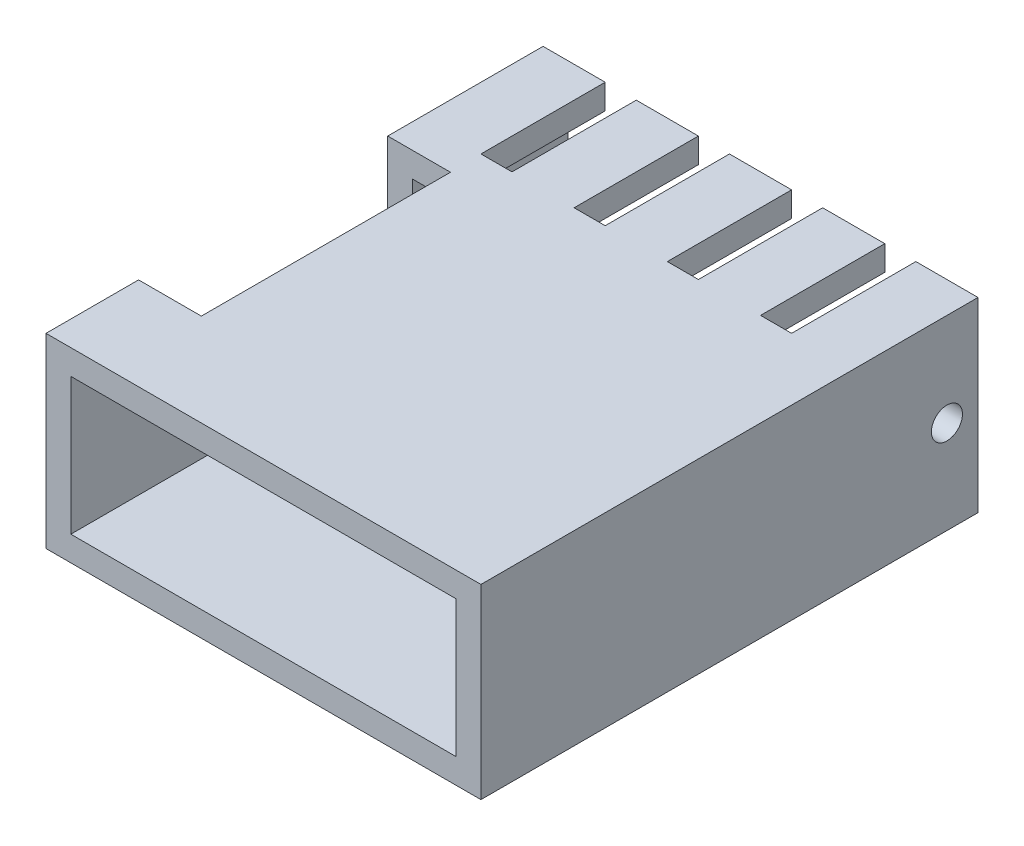
from build123d import *

# Parameters (mm, degrees)
SKETCH1_W               = 88.9
SKETCH1_H               = 101.6
BOSS_EXTRUDE1_DEPTH     = 38.1
SHELL1_T                = -5.08
CUT_EXTRUDE3_START      = -19.05
SKETCH4_W               = 12.827
SKETCH4_H               = 50.927
CUT_EXTRUDE3_DEPTH      = 122.226084918
SKETCH5_W               = 6.35
SKETCH5_H               = 25.4
CUT_EXTRUDE4_DEPTH      = 141.276084918
CUT_EXTRUDE5_DEPTH      = 4.2672
CUT_EXTRUDE5_DEPTH_BACK = 141.276084918
SKETCH6_R               = 3.175


with BuildPart() as part:
    # Sketch1 → Boss-Extrude1 (new body)
    with BuildSketch(Plane(origin=(0, 0, 0), x_dir=(1, 0, 0), z_dir=(0, 1, 0))):
        with Locations((44.45, 50.8)):
            Rectangle(SKETCH1_W, SKETCH1_H)
    extrude(amount=BOSS_EXTRUDE1_DEPTH)

    # Shell1
    shell1_openings = [part.faces().sort_by_distance(p)[0] for p in [
        (44.45, 19.05, -101.6),
        (44.45, 19.05, 0),
    ]]
    offset(amount=SHELL1_T, openings=shell1_openings, kind=Kind.INTERSECTION)

    # Sketch4 → Cut-Extrude3 (cut, through all)
    with BuildSketch(Plane.XZ.offset(CUT_EXTRUDE3_START)):
        with Locations((6.4135, -44.3865)):
            Rectangle(SKETCH4_W, SKETCH4_H)
    extrude(amount=-CUT_EXTRUDE3_DEPTH, mode=Mode.SUBTRACT)

    # Sketch5 → Cut-Extrude4 (cut, through all)
    with BuildSketch(Plane(origin=(0, 38.1, 0), x_dir=(1, 0, 0), z_dir=(0, 1, 0))):
        with Locations((15.875, 88.9)):
            Rectangle(SKETCH5_W, SKETCH5_H)
        with Locations((34.925, 88.9)):
            Rectangle(SKETCH5_W, SKETCH5_H)
        with Locations((53.975, 88.9)):
            Rectangle(SKETCH5_W, SKETCH5_H)
        with Locations((73.025, 88.9)):
            Rectangle(SKETCH5_W, SKETCH5_H)
    extrude(amount=-CUT_EXTRUDE4_DEPTH, mode=Mode.SUBTRACT)

    # Sketch6 → Cut-Extrude5 (cut, two sides: drawn at the far end of the back side and taken through both)
    with BuildSketch(Plane.ZY.offset(-CUT_EXTRUDE5_DEPTH_BACK)):
        with Locations((-95.25, 19.05)):
            Circle(SKETCH6_R)
    extrude(amount=CUT_EXTRUDE5_DEPTH + CUT_EXTRUDE5_DEPTH_BACK, mode=Mode.SUBTRACT)


solid = part.part
